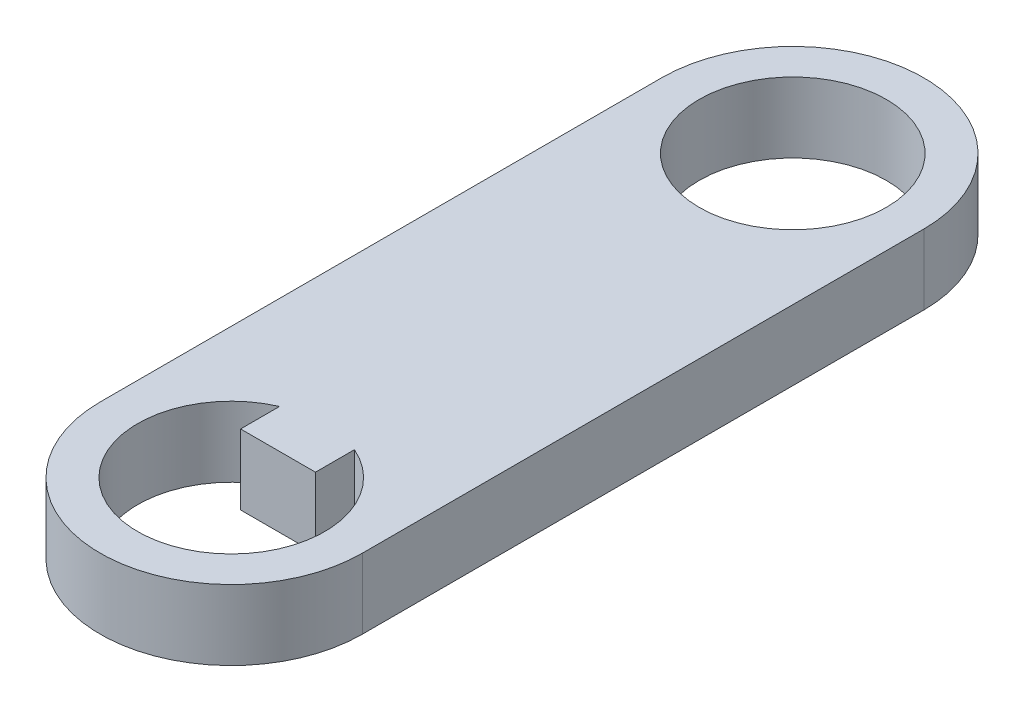
from build123d import *

# Parameters (mm, degrees)
SKETCH1_R           = 10
BOSS_EXTRUDE1_DEPTH = 7.5


with BuildPart() as part:
    # Sketch1 → Boss-Extrude1 (new body)
    with BuildSketch(Plane(origin=(0, 0, 0), x_dir=(1, 0, 0), z_dir=(0, 1, 0))):
        with BuildLine():
            Line((14, 0), (14, 60))
            ThreePointArc((14, 60), (0, 74), (-14, 60))
            Line((-14, 60), (-14, 0))
            ThreePointArc((-14, 0), (0, -14), (14, 0))
        make_face()
        with BuildLine():
            Line((-4, 9.16515139), (-4, 5))
            Line((-4, 5), (4, 5))
            Line((4, 5), (4, 9.16515139))
            ThreePointArc((4, 9.16515139), (0, -10), (-4, 9.16515139))
        make_face(mode=Mode.SUBTRACT)
        with Locations((0, 60)):
            Circle(SKETCH1_R, mode=Mode.SUBTRACT)
    extrude(amount=BOSS_EXTRUDE1_DEPTH)


solid = part.part
